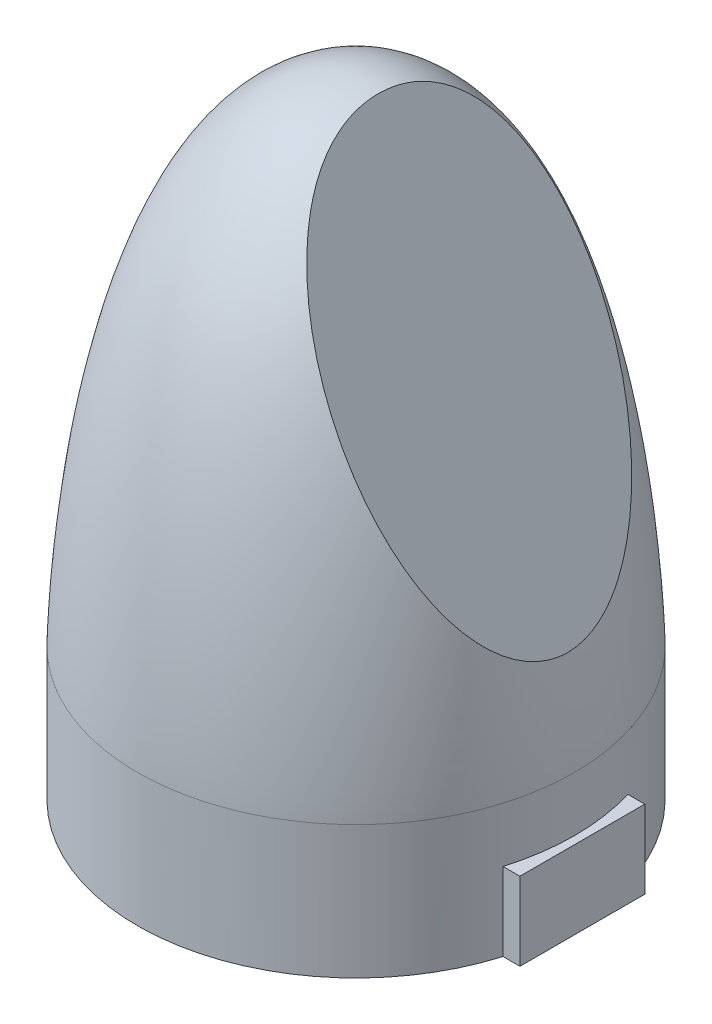
from build123d import *

# Parameters (mm, degrees)
SCALE2_SCALE           = 2
CUT_EXTRUDE1_START     = 15.280040905
CUT_EXTRUDE1_OUTLINE_W = 31
CUT_EXTRUDE1_OUTLINE_H = 20
CUT_EXTRUDE1_DEPTH     = 3.866864707
SKETCH3_W              = 4
SKETCH3_H              = 8
BOSS_EXTRUDE1_DEPTH    = 5


# Read off the part's stored shape, not the designer's step: Cut-Extrude1
with BuildPart() as part:
    # Sketch1 → Revolve1 (revolve)
    with BuildSketch(Plane.XY, mode=Mode.PRIVATE) as revolve1_sk:
        with BuildLine():
            Line((7, 4.256292026), (7, 0))
            Line((7, 0), (0, 0))
            Line((0, 0), (0, 20))
            add(Edge.make_bspline(
                [(0, 20), (6.748759859, 19.983290112), (7.005059619, 4.256663996), (7, 4.256292026)],
                knots=[0, 0, 0, 0, 0.166417438, 0.166417438, 0.166417438, 0.166417438], degree=3))
        make_face()
    revolve(revolve1_sk.sketch.rotate(Axis((0, 0, 0), (0, 1, 0)), 90), axis=Axis((0, 0, 0), (0, 1, 0)))


with BuildPart() as part_1:
    # Scale2: scaled about (0, 7.913014441, 0)
    add(part.part.scale(SCALE2_SCALE).moved(Location((0, -7.913014441, 0))))

    # Cut-Extrude1 outline → Cut-Extrude1 (cut)
    with BuildSketch(Plane(origin=(0, 0, 0), x_dir=(0.43801694528234036, -0.8989667155381935, 0), z_dir=(0.8989667155381934, 0.4380169452823407, 0)).offset(CUT_EXTRUDE1_START)):
        with Locations((-14.5, 0)):
            Rectangle(CUT_EXTRUDE1_OUTLINE_W, CUT_EXTRUDE1_OUTLINE_H)
    extrude(amount=CUT_EXTRUDE1_DEPTH, mode=Mode.SUBTRACT)

    # Sketch3 → Boss-Extrude1 (add)
    with BuildSketch(Plane(origin=(0, -7.913030029, 0), x_dir=(-1, 0, 0), z_dir=(0, -1, 0))):
        with Locations((-12.5, 0)):
            Rectangle(SKETCH3_W, SKETCH3_H)
    extrude(amount=-BOSS_EXTRUDE1_DEPTH)


solid = part_1.part
